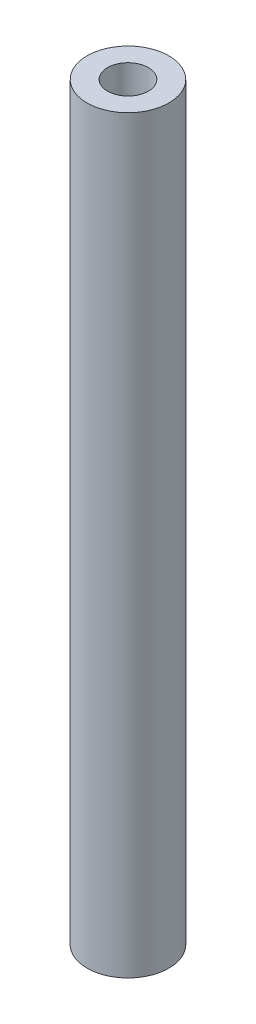
from build123d import *

# Parameters (mm, degrees)
SKETCH1_R           = 3
SKETCH1_R_2         = 1.5
BOSS_EXTRUDE1_DEPTH = 55


with BuildPart() as part:
    # Sketch1 → Boss-Extrude1 (new body)
    with BuildSketch(Plane(origin=(0, 0, 0), x_dir=(1, 0, 0), z_dir=(0, 1, 0))):
        Circle(SKETCH1_R)
        Circle(SKETCH1_R_2, mode=Mode.SUBTRACT)
    extrude(amount=BOSS_EXTRUDE1_DEPTH)


solid = part.part
